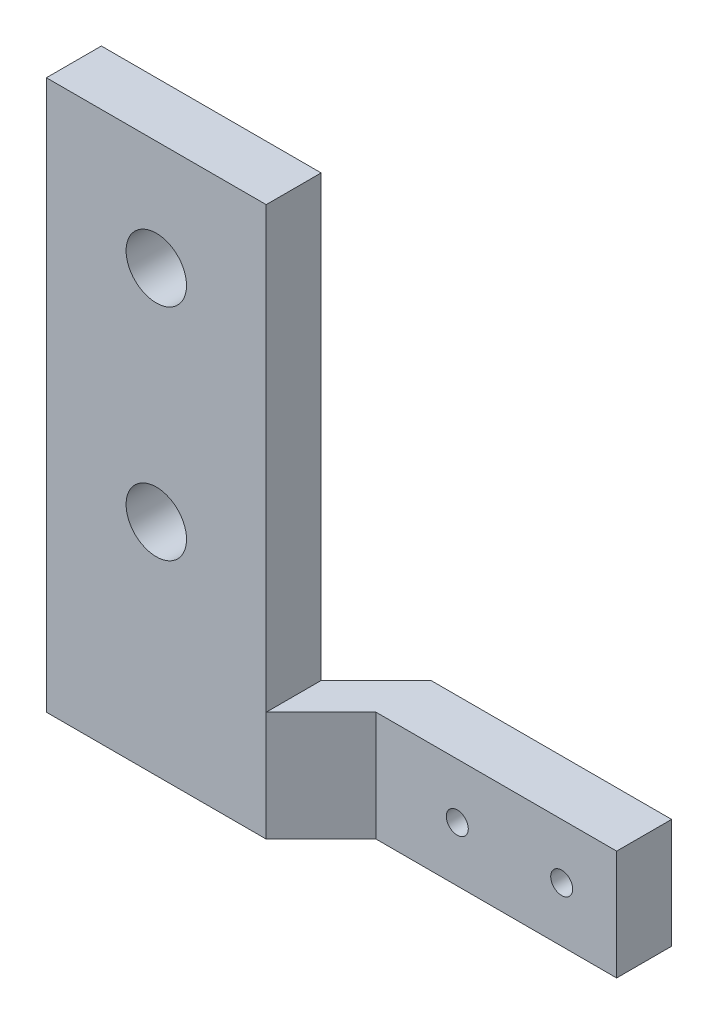
from build123d import *

# Parameters (mm, degrees)
ESQUISSE1_W             = 20
ESQUISSE1_H             = 50
ESQUISSE1_R             = 2.75
BOSS_EXTRU_1_DEPTH      = 5
BOSS_EXTRU_2_DEPTH      = 10
ENL_V_MAT_EXTRU_1_REACH = 48.579
ESQUISSE3_R             = 1


with BuildPart() as part:
    # Esquisse1 → Boss.-Extru.1 (new body)
    with BuildSketch(Plane.XY):
        with Locations((-27.825146679, 1.717727711)):
            Rectangle(ESQUISSE1_W, ESQUISSE1_H)
        with Locations((-27.825146679, 16.717727711)):
            Circle(ESQUISSE1_R, mode=Mode.SUBTRACT)
        with Locations((-27.825146679, -3.282272289)):
            Circle(ESQUISSE1_R, mode=Mode.SUBTRACT)
    extrude(amount=BOSS_EXTRU_1_DEPTH)

    # Esquisse2 → Boss.-Extru.2 (add)
    with BuildSketch(Plane.XZ.offset(23.282272289)):
        Polygon((-17.825146679, 0), (-17.825146679, 5), (-12.825146679, 0), (9.063128198, 0), (9.063128198, -5), (-12.825146679, -5), align=None)
    extrude(amount=-BOSS_EXTRU_2_DEPTH)

    # Esquisse3 → Enlèv. mat.-Extru.1 (cut, up to next)
    with BuildSketch(Plane.XY, mode=Mode.PRIVATE) as enl_v_mat_extru_1_sk1:
        with Locations((4.063128198, -18.282272289)):
            Circle(ESQUISSE3_R)
    enl_v_mat_extru_1_tool1 = extrude(enl_v_mat_extru_1_sk1.sketch, amount=-ENL_V_MAT_EXTRU_1_REACH, mode=Mode.PRIVATE) & part.part
    # Esquisse3 → Enlèv. mat.-Extru.1 (cut, up to next)
    with BuildSketch(Plane.XY, mode=Mode.PRIVATE) as enl_v_mat_extru_1_sk2:
        with Locations((-5.436871802, -18.282272289)):
            Circle(ESQUISSE3_R)
    enl_v_mat_extru_1_tool2 = extrude(enl_v_mat_extru_1_sk2.sketch, amount=-ENL_V_MAT_EXTRU_1_REACH, mode=Mode.PRIVATE) & part.part
    add(enl_v_mat_extru_1_tool1.solids().sort_by_distance((4.063128, -18.282272, 0))[0], mode=Mode.SUBTRACT)
    add(enl_v_mat_extru_1_tool2.solids().sort_by_distance((-5.436872, -18.282272, 0))[0], mode=Mode.SUBTRACT)


solid = part.part
